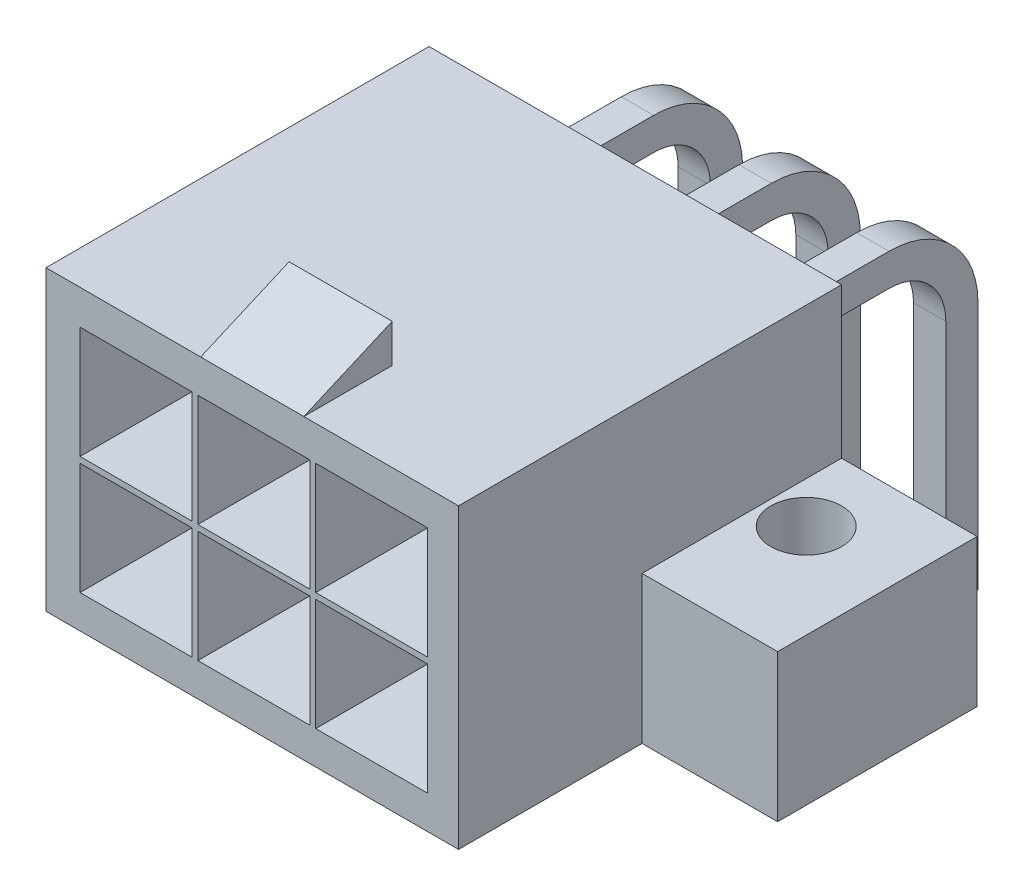
from build123d import *

# Parameters (mm, degrees)
SKETCH1_W           = 14
SKETCH1_H           = 13
BOSS_EXTRUDE1_DEPTH = 10.1
SKETCH2_W           = 3.5
SKETCH2_H           = 3
BOSS_EXTRUDE2_DEPTH = 1.3
CUT_EXTRUDE1_REACH  = 21.378
SKETCH4_W           = 6.77
SKETCH4_H           = 5
BOSS_EXTRUDE3_DEPTH = 4.6
SKETCH5_W           = 6.77
SKETCH5_H           = 5
BOSS_EXTRUDE4_DEPTH = 4.6
SKETCH6_W           = 3.8
SKETCH6_H           = 3.8
CUT_EXTRUDE2_DEPTH  = 9.2
SKETCH7_W           = 1.094306831
SKETCH7_H           = 1.09430683
SKETCH7_W_2         = 1.09430683
BOSS_EXTRUDE5_DEPTH = 10
SWEEP2_START        = 2.5
SWEEP2_DEPTH        = 1.094306831
SWEEP2_START_2      = 6.494306831
SWEEP2_2_DEPTH      = 1.09430683
SWEEP2_START_3      = 10.488613661
SWEEP2_3_DEPTH      = 1.094306831
SKETCH10_W          = 1.09430683
SKETCH10_H          = 1.09
SKETCH10_W_2        = 1.077227458
SKETCH10_H_2        = 1.094306831
SKETCH10_W_3        = 1.09
SKETCH10_2_W        = 1.09430683
SKETCH10_2_H        = 1.09
SKETCH10_2_W_2      = 1.077227458
SKETCH10_2_H_2      = 1.094306831
SKETCH10_2_W_3      = 1.09
BOSS_EXTRUDE6_DEPTH = 10
SKETCH12_R          = 1.2
CUT_EXTRUDE3_DEPTH  = 30.627830836


# Read off the part's stored shape, not the designer's step: Sweep2
with BuildPart() as part:
    # Sketch1 → Boss-Extrude1 (new body)
    with BuildSketch(Plane(origin=(0, 0, 0), x_dir=(1, 0, 0), z_dir=(0, 1, 0))):
        with Locations((7, 6.5)):
            Rectangle(SKETCH1_W, SKETCH1_H)
    extrude(amount=BOSS_EXTRUDE1_DEPTH)

    # Sketch2 → Boss-Extrude2 (add)
    with BuildSketch(Plane(origin=(0, 10.1, 0), x_dir=(1, 0, 0), z_dir=(0, 1, 0))):
        with Locations((7, 1.5)):
            Rectangle(SKETCH2_W, SKETCH2_H)
    extrude(amount=BOSS_EXTRUDE2_DEPTH)

    # Sketch3 → Cut-Extrude1 (cut, up to next)
    with BuildSketch(Plane(origin=(8.75, 0, 0), x_dir=(0, 0, -1), z_dir=(1, 0, 0)), mode=Mode.PRIVATE) as cut_extrude1_sk1:
        Polygon((0, 10.1), (3, 11.4), (0, 11.4), align=None)
    cut_extrude1_tool1 = extrude(cut_extrude1_sk1.sketch, amount=-CUT_EXTRUDE1_REACH, mode=Mode.PRIVATE) & part.part
    add(cut_extrude1_tool1.solids().sort_by_distance((8.75, 10.966667, -1))[0], mode=Mode.SUBTRACT)

    # Sketch4 → Boss-Extrude3 (add)
    with BuildSketch(Plane(origin=(14, 0, 0), x_dir=(0, 0, -1), z_dir=(1, 0, 0))):
        with Locations((9.615, 2.5)):
            Rectangle(SKETCH4_W, SKETCH4_H)
    extrude(amount=BOSS_EXTRUDE3_DEPTH)

    # Sketch5 → Boss-Extrude4 (add)
    with BuildSketch(Plane.ZY):
        with Locations((-9.615, 2.5)):
            Rectangle(SKETCH5_W, SKETCH5_H)
    extrude(amount=BOSS_EXTRUDE4_DEPTH)

    # Sketch6 → Cut-Extrude2 (cut)
    with BuildSketch(Plane.XY):
        with Locations((3.054030332, 7.029063078)):
            Rectangle(SKETCH6_W, SKETCH6_H)
        with Locations((11.054030332, 3.029063078)):
            Rectangle(SKETCH6_W, SKETCH6_H)
        with Locations((11.054030332, 7.029063078)):
            Rectangle(SKETCH6_W, SKETCH6_H)
        with Locations((3.054030332, 3.029063078)):
            Rectangle(SKETCH6_W, SKETCH6_H)
        with Locations((7.054030332, 7.029063078)):
            Rectangle(SKETCH6_W, SKETCH6_H)
        with Locations((7.054030332, 3.029063078)):
            Rectangle(SKETCH6_W, SKETCH6_H)
    extrude(amount=-CUT_EXTRUDE2_DEPTH, mode=Mode.SUBTRACT)

    # Sketch7 → Boss-Extrude5 (add)
    with BuildSketch(Plane(origin=(0, 0, -13), x_dir=(-1, 0, 0), z_dir=(0, 0, -1))):
        with Locations((-11.035767077, 7.313802256)):
            Rectangle(SKETCH7_W, SKETCH7_H)
        with Locations((-7.041460246, 7.313802256)):
            Rectangle(SKETCH7_W_2, SKETCH7_H)
        with Locations((-3.047153416, 7.313802256)):
            Rectangle(SKETCH7_W, SKETCH7_H)
    extrude(amount=-BOSS_EXTRUDE5_DEPTH)

    # Sweep2 outline → Sweep2 (add)
    with BuildSketch(Plane.YZ.offset(SWEEP2_START)):
        with BuildLine():
            Line((7.860955671, -17.025339082), (7.860955671, -13))
            Line((7.860955671, -13), (6.766648841, -13))
            Line((6.766648841, -13), (6.766648841, -17.025339082))
            ThreePointArc((6.766648841, -17.025339082), (6.202094964, -18.388292708), (4.839141338, -18.952846585))
            Line((4.839141338, -18.952846585), (-3.6, -18.952846585))
            Line((-3.6, -18.952846585), (-3.6, -20.047153415))
            Line((-3.6, -20.047153415), (4.839141338, -20.047153415))
            ThreePointArc((4.839141338, -20.047153415), (6.975886745, -19.162084489), (7.860955671, -17.025339082))
        make_face()
    extrude(amount=SWEEP2_DEPTH)

    # Sweep2 2 outline → Sweep2 2 (add)
    with BuildSketch(Plane.YZ.offset(SWEEP2_START_2)):
        with BuildLine():
            Line((7.860955671, -17.025339082), (7.860955671, -13))
            Line((7.860955671, -13), (6.766648841, -13))
            Line((6.766648841, -13), (6.766648841, -17.025339082))
            ThreePointArc((6.766648841, -17.025339082), (6.202094964, -18.388292708), (4.839141338, -18.952846585))
            Line((4.839141338, -18.952846585), (-3.6, -18.952846585))
            Line((-3.6, -18.952846585), (-3.6, -20.047153415))
            Line((-3.6, -20.047153415), (4.839141338, -20.047153415))
            ThreePointArc((4.839141338, -20.047153415), (6.975886745, -19.162084489), (7.860955671, -17.025339082))
        make_face()
    extrude(amount=SWEEP2_2_DEPTH)

    # Sweep2 3 outline → Sweep2 3 (add)
    with BuildSketch(Plane.YZ.offset(SWEEP2_START_3)):
        with BuildLine():
            Line((7.860955671, -17.025339082), (7.860955671, -13))
            Line((7.860955671, -13), (6.766648841, -13))
            Line((6.766648841, -13), (6.766648841, -17.025339082))
            ThreePointArc((6.766648841, -17.025339082), (6.202094964, -18.388292708), (4.839141338, -18.952846585))
            Line((4.839141338, -18.952846585), (-3.6, -18.952846585))
            Line((-3.6, -18.952846585), (-3.6, -20.047153415))
            Line((-3.6, -20.047153415), (4.839141338, -20.047153415))
            ThreePointArc((4.839141338, -20.047153415), (6.975886745, -19.162084489), (7.860955671, -17.025339082))
        make_face()
    extrude(amount=SWEEP2_3_DEPTH)

    # Sweep3: sweep along a path in Sketch11
    with BuildLine(Plane(origin=(4, 0, 0), x_dir=(0, 0, -1), z_dir=(1, 0, 0))) as sweep3_path:
        Line((14, -3.6), (14, 0))
        Line((14, 0), (14, 1.79191881))
        ThreePointArc((14, 1.79191881), (13.707106781, 2.499025591), (13, 2.79191881))
    # Sketch10 → Sweep3 (sweep)
    with BuildSketch(Plane(origin=(0, 0, -13), x_dir=(-1, 0, 0), z_dir=(0, 0, -1))):
        with Locations((-3.0642338, 2.79191881)):
            Rectangle(SKETCH10_W, SKETCH10_H)
        with Locations((-7.049999932, 2.789495426)):
            Rectangle(SKETCH10_W_2, SKETCH10_H_2)
        with Locations((-11.033613661, 2.789495426)):
            Rectangle(SKETCH10_W_3, SKETCH10_H_2)
    sweep(path=sweep3_path.line)

    # Sketch10<2> → Boss-Extrude6 (add)
    with BuildSketch(Plane(origin=(0, 0, -13), x_dir=(-1, 0, 0), z_dir=(0, 0, -1))):
        with Locations((-3.0642338, 2.79191881)):
            Rectangle(SKETCH10_2_W, SKETCH10_2_H)
        with Locations((-7.049999932, 2.789495426)):
            Rectangle(SKETCH10_2_W_2, SKETCH10_2_H_2)
        with Locations((-11.033613661, 2.789495426)):
            Rectangle(SKETCH10_2_W_3, SKETCH10_2_H_2)
    extrude(amount=-BOSS_EXTRUDE6_DEPTH)

    # Sketch12 → Cut-Extrude3 (cut, through all)
    with BuildSketch(Plane.XZ):
        with Locations(Location((-1.4, -10.4, 0), (0, 0, 270))):
            Circle(SKETCH12_R)
        with Locations(Location((15.4, -10.4, 0), (0, 0, 270))):
            Circle(SKETCH12_R)
    extrude(amount=-CUT_EXTRUDE3_DEPTH, mode=Mode.SUBTRACT)


solid = part.part
